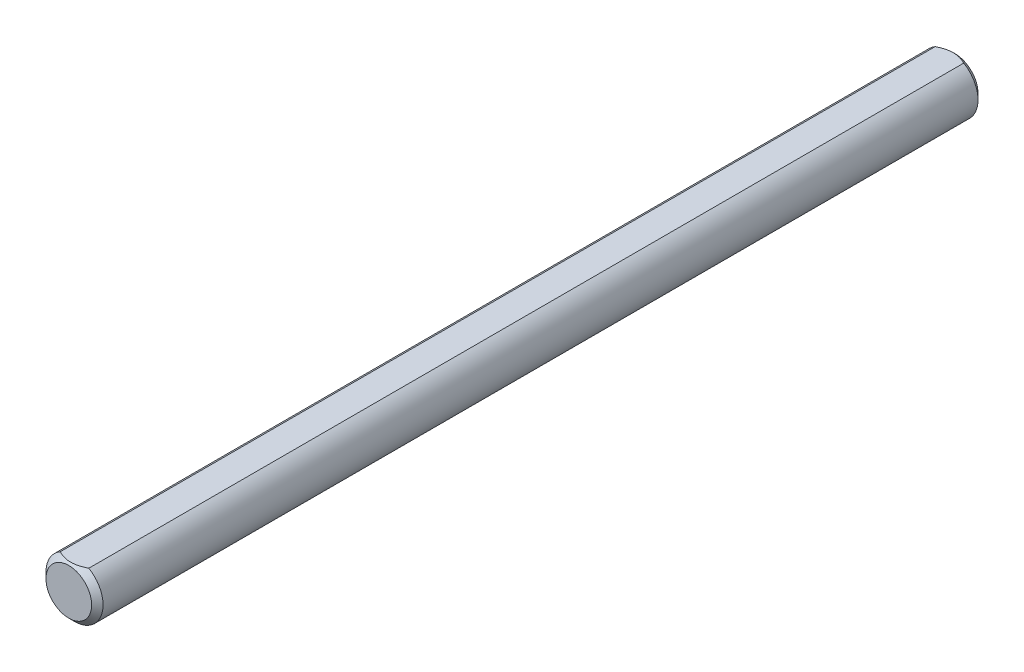
from build123d import *

# Parameters (mm, degrees)
SKETCH1_R           = 3.175
EXTRUDE1_DEPTH      = 49.276
CHAMFER1_SIZE       = 0.635
EXTRUDE7_DEPTH      = 50.480151839
EXTRUDE7_DEPTH_BACK = 50.480151839


with BuildPart() as part:
    # Sketch1 → Extrude1 (new, symmetric)
    with BuildSketch(Plane.XY):
        Circle(SKETCH1_R)
    extrude(amount=EXTRUDE1_DEPTH, both=True)

    # Chamfer1
    chamfer1_edges = [part.edges().sort_by_distance(p)[0] for p in [
        (-3.175, 0, -49.276),
        (-3.175, 0, 49.276),
    ]]
    chamfer(chamfer1_edges, length=CHAMFER1_SIZE)

    # Sketch13 → Extrude7 (cut, two sides: drawn at the far end of the back side and taken through both)
    with BuildSketch(Plane.XY.offset(-EXTRUDE7_DEPTH_BACK)):
        with BuildLine():
            Line((-1.5875, 2.749630657), (1.5875, 2.749630657))
            ThreePointArc((1.5875, 2.749630657), (0, 3.175), (-1.5875, 2.749630657))
        make_face()
    extrude(amount=EXTRUDE7_DEPTH + EXTRUDE7_DEPTH_BACK, mode=Mode.SUBTRACT)


solid = part.part
